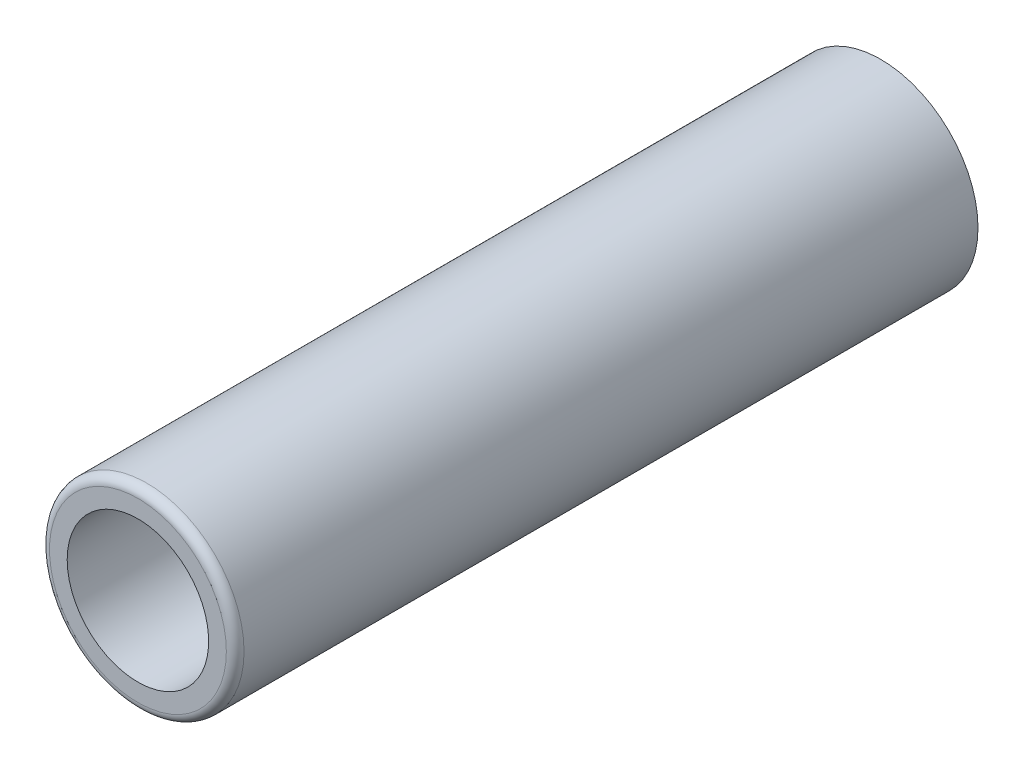
from build123d import *

# Parameters (mm, degrees)
SCHIZZO1_R                   = 55
ESTRUSIONE_ESTRUSIONE1_DEPTH = 420
SCHIZZO2_R                   = 40
TAGLIO_ESTRUSIONE1_DEPTH     = 428.141662683
RACCORDO1_R                  = 5


with BuildPart() as part:
    # Schizzo1 → Estrusione-Estrusione1 (new body)
    with BuildSketch(Plane.XY):
        Circle(SCHIZZO1_R)
    extrude(amount=ESTRUSIONE_ESTRUSIONE1_DEPTH)

    # Schizzo2 → Taglio-Estrusione1 (cut, through all)
    with BuildSketch(Plane(origin=(0, 0, 0), x_dir=(-1, 0, 0), z_dir=(0, 0, -1))):
        Circle(SCHIZZO2_R)
    extrude(amount=-TAGLIO_ESTRUSIONE1_DEPTH, mode=Mode.SUBTRACT)

    # Raccordo1
    raccordo1_edges = [part.edges().sort_by_distance(p)[0] for p in [
        (-55, 0, 420),
    ]]
    fillet(raccordo1_edges, radius=RACCORDO1_R)


solid = part.part
